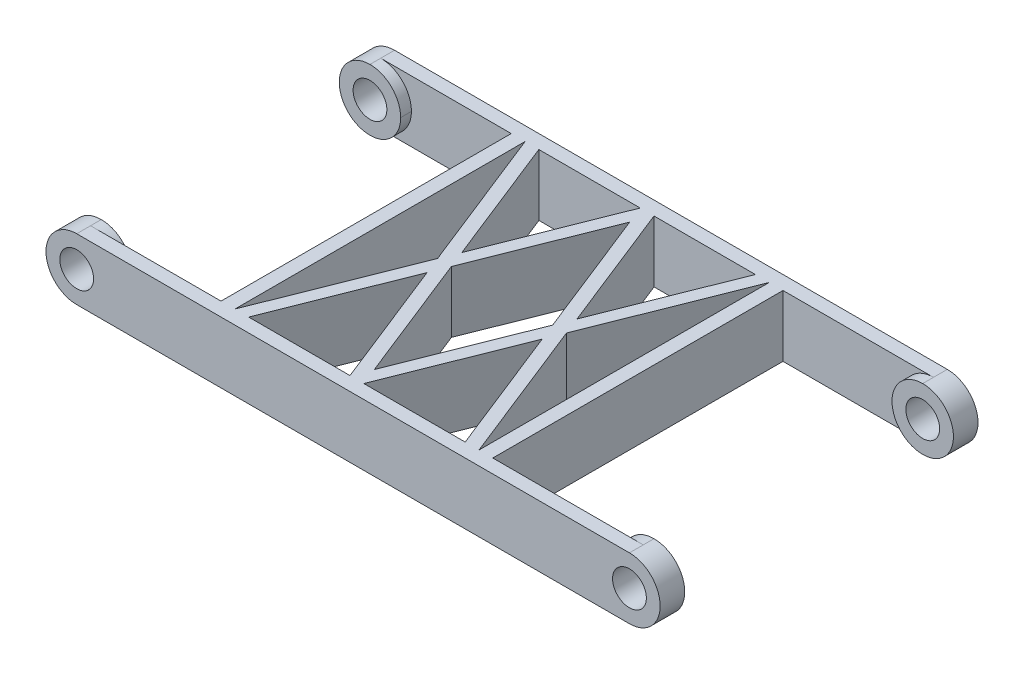
from build123d import *

# Parameters (mm, degrees)
SKETCH1_R           = 11
BOSS_EXTRUDE1_DEPTH = 103.5
CUT_EXTRUDE1_REACH  = 230.719
SKETCH5_W           = 20
SKETCH5_H           = 175
FILLET1_R           = 20


with BuildPart() as part:
    # Sketch1 → Boss-Extrude1 (new, symmetric)
    with BuildSketch(Plane.XY):
        with BuildLine():
            Line((-180, -20), (180, -20))
            ThreePointArc((180, -20), (200, 0), (180, 20))
            Line((180, 20), (-180, 20))
            ThreePointArc((-180, 20), (-200, 0), (-180, -20))
        make_face()
        with Locations((-180, 0)):
            Circle(SKETCH1_R, mode=Mode.SUBTRACT)
        with Locations((180, 0)):
            Circle(SKETCH1_R, mode=Mode.SUBTRACT)
    extrude(amount=BOSS_EXTRUDE1_DEPTH, both=True)

    # Cut-Extrude1: up to this face of the body (flat: up to its plane)
    cut_extrude1_end = Plane(part.part.faces().sort_by_distance((0, -20, 0))[0])
    # Sketch5 → Cut-Extrude1 (cut, up to the picked face)
    with BuildSketch(Plane(origin=(0, 20, 0), x_dir=(1, 0, 0), z_dir=(0, 1, 0)), mode=Mode.PRIVATE) as cut_extrude1_sk1:
        Polygon((-95, -94.5), (-95, 94.5), (-160, 94.5), (-160, 87.5), (-180, 87.5), (-180, -87.5), (-160, -87.5), (-160, -94.5), align=None)
    cut_extrude1_tool1 = split(extrude(cut_extrude1_sk1.sketch, amount=-CUT_EXTRUDE1_REACH, mode=Mode.PRIVATE), bisect_by=cut_extrude1_end, keep=Keep.BOTH, mode=Mode.PRIVATE)
    # Sketch5 → Cut-Extrude1 (cut, up to the picked face)
    with BuildSketch(Plane(origin=(0, 20, 0), x_dir=(1, 0, 0), z_dir=(0, 1, 0)), mode=Mode.PRIVATE) as cut_extrude1_sk2:
        with Locations((-190, 0)):
            Rectangle(SKETCH5_W, SKETCH5_H)
    cut_extrude1_tool2 = split(extrude(cut_extrude1_sk2.sketch, amount=-CUT_EXTRUDE1_REACH, mode=Mode.PRIVATE), bisect_by=cut_extrude1_end, keep=Keep.BOTH, mode=Mode.PRIVATE)
    # Sketch5 → Cut-Extrude1 (cut, up to the picked face)
    with BuildSketch(Plane(origin=(0, 20, 0), x_dir=(1, 0, 0), z_dir=(0, 1, 0)), mode=Mode.PRIVATE) as cut_extrude1_sk3:
        Polygon((-48.5, 0), (-86, 94.5), (-86, -94.5), align=None)
    cut_extrude1_tool3 = split(extrude(cut_extrude1_sk3.sketch, amount=-CUT_EXTRUDE1_REACH, mode=Mode.PRIVATE), bisect_by=cut_extrude1_end, keep=Keep.BOTH, mode=Mode.PRIVATE)
    # Sketch5 → Cut-Extrude1 (cut, up to the picked face)
    with BuildSketch(Plane(origin=(0, 20, 0), x_dir=(1, 0, 0), z_dir=(0, 1, 0)), mode=Mode.PRIVATE) as cut_extrude1_sk4:
        Polygon((-11, 94.5), (-77, 94.5), (-44, 11.34), align=None)
    cut_extrude1_tool4 = split(extrude(cut_extrude1_sk4.sketch, amount=-CUT_EXTRUDE1_REACH, mode=Mode.PRIVATE), bisect_by=cut_extrude1_end, keep=Keep.BOTH, mode=Mode.PRIVATE)
    # Sketch5 → Cut-Extrude1 (cut, up to the picked face)
    with BuildSketch(Plane(origin=(0, 20, 0), x_dir=(1, 0, 0), z_dir=(0, 1, 0)), mode=Mode.PRIVATE) as cut_extrude1_sk5:
        Polygon((26.5, 0), (-6.5, 83.16), (-39.5, 0), (-6.5, -83.16), align=None)
    cut_extrude1_tool5 = split(extrude(cut_extrude1_sk5.sketch, amount=-CUT_EXTRUDE1_REACH, mode=Mode.PRIVATE), bisect_by=cut_extrude1_end, keep=Keep.BOTH, mode=Mode.PRIVATE)
    # Sketch5 → Cut-Extrude1 (cut, up to the picked face)
    with BuildSketch(Plane(origin=(0, 20, 0), x_dir=(1, 0, 0), z_dir=(0, 1, 0)), mode=Mode.PRIVATE) as cut_extrude1_sk6:
        Polygon((-44, -11.34), (-77, -94.5), (-11, -94.5), align=None)
    cut_extrude1_tool6 = split(extrude(cut_extrude1_sk6.sketch, amount=-CUT_EXTRUDE1_REACH, mode=Mode.PRIVATE), bisect_by=cut_extrude1_end, keep=Keep.BOTH, mode=Mode.PRIVATE)
    # Sketch5 → Cut-Extrude1 (cut, up to the picked face)
    with BuildSketch(Plane(origin=(0, 20, 0), x_dir=(1, 0, 0), z_dir=(0, 1, 0)), mode=Mode.PRIVATE) as cut_extrude1_sk7:
        Polygon((64, 94.5), (-2, 94.5), (31, 11.34), align=None)
    cut_extrude1_tool7 = split(extrude(cut_extrude1_sk7.sketch, amount=-CUT_EXTRUDE1_REACH, mode=Mode.PRIVATE), bisect_by=cut_extrude1_end, keep=Keep.BOTH, mode=Mode.PRIVATE)
    # Sketch5 → Cut-Extrude1 (cut, up to the picked face)
    with BuildSketch(Plane(origin=(0, 20, 0), x_dir=(1, 0, 0), z_dir=(0, 1, 0)), mode=Mode.PRIVATE) as cut_extrude1_sk8:
        Polygon((73, -94.5), (73, 94.5), (35.5, 0), align=None)
    cut_extrude1_tool8 = split(extrude(cut_extrude1_sk8.sketch, amount=-CUT_EXTRUDE1_REACH, mode=Mode.PRIVATE), bisect_by=cut_extrude1_end, keep=Keep.BOTH, mode=Mode.PRIVATE)
    # Sketch5 → Cut-Extrude1 (cut, up to the picked face)
    with BuildSketch(Plane(origin=(0, 20, 0), x_dir=(1, 0, 0), z_dir=(0, 1, 0)), mode=Mode.PRIVATE) as cut_extrude1_sk9:
        Polygon((31, -11.34), (-2, -94.5), (64, -94.5), align=None)
    cut_extrude1_tool9 = split(extrude(cut_extrude1_sk9.sketch, amount=-CUT_EXTRUDE1_REACH, mode=Mode.PRIVATE), bisect_by=cut_extrude1_end, keep=Keep.BOTH, mode=Mode.PRIVATE)
    # Sketch5 → Cut-Extrude1 (cut, up to the picked face)
    with BuildSketch(Plane(origin=(0, 20, 0), x_dir=(1, 0, 0), z_dir=(0, 1, 0)), mode=Mode.PRIVATE) as cut_extrude1_sk10:
        Polygon((160, 87.5), (160, 94.5), (82, 94.5), (82, -94.5), (160, -94.5), (160, -87.5), (180, -87.5), (180, 87.5), align=None)
    cut_extrude1_tool10 = split(extrude(cut_extrude1_sk10.sketch, amount=-CUT_EXTRUDE1_REACH, mode=Mode.PRIVATE), bisect_by=cut_extrude1_end, keep=Keep.BOTH, mode=Mode.PRIVATE)
    # Sketch5 → Cut-Extrude1 (cut, up to the picked face)
    with BuildSketch(Plane(origin=(0, 20, 0), x_dir=(1, 0, 0), z_dir=(0, 1, 0)), mode=Mode.PRIVATE) as cut_extrude1_sk11:
        with Locations((190, 0)):
            Rectangle(SKETCH5_W, SKETCH5_H)
    cut_extrude1_tool11 = split(extrude(cut_extrude1_sk11.sketch, amount=-CUT_EXTRUDE1_REACH, mode=Mode.PRIVATE), bisect_by=cut_extrude1_end, keep=Keep.BOTH, mode=Mode.PRIVATE)
    add(cut_extrude1_tool1.solids().sort_by(Axis((-136.923503, 20, 0), (0, -1, 0)))[0], mode=Mode.SUBTRACT)
    add(cut_extrude1_tool2.solids().sort_by(Axis((-190, 20, 0), (0, -1, 0)))[0], mode=Mode.SUBTRACT)
    add(cut_extrude1_tool3.solids().sort_by(Axis((-73.5, 20, 0), (0, -1, 0)))[0], mode=Mode.SUBTRACT)
    add(cut_extrude1_tool4.solids().sort_by(Axis((-44, 20, -66.78), (0, -1, 0)))[0], mode=Mode.SUBTRACT)
    add(cut_extrude1_tool5.solids().sort_by(Axis((-6.5, 20, 0), (0, -1, 0)))[0], mode=Mode.SUBTRACT)
    add(cut_extrude1_tool6.solids().sort_by(Axis((-44, 20, 66.78), (0, -1, 0)))[0], mode=Mode.SUBTRACT)
    add(cut_extrude1_tool7.solids().sort_by(Axis((31, 20, -66.78), (0, -1, 0)))[0], mode=Mode.SUBTRACT)
    add(cut_extrude1_tool8.solids().sort_by(Axis((60.5, 20, 0), (0, -1, 0)))[0], mode=Mode.SUBTRACT)
    add(cut_extrude1_tool9.solids().sort_by(Axis((31, 20, 66.78), (0, -1, 0)))[0], mode=Mode.SUBTRACT)
    add(cut_extrude1_tool10.solids().sort_by(Axis((130.401381, 20, 0), (0, -1, 0)))[0], mode=Mode.SUBTRACT)
    add(cut_extrude1_tool11.solids().sort_by(Axis((190, 20, 0), (0, -1, 0)))[0], mode=Mode.SUBTRACT)

    # Fillet1
    fillet1_edges = [part.edges().sort_by_distance(p)[0] for p in [
        (160, -20, 91),
        (160, 20, 91),
        (160, -20, -91),
        (160, 20, -91),
        (-160, -20, 91),
        (-160, 20, 91),
        (-160, -20, -91),
        (-160, 20, -91),
    ]]
    fillet(fillet1_edges, radius=FILLET1_R - 0.0001)  # a hair under: the kernel refuses the full size


solid = part.part
